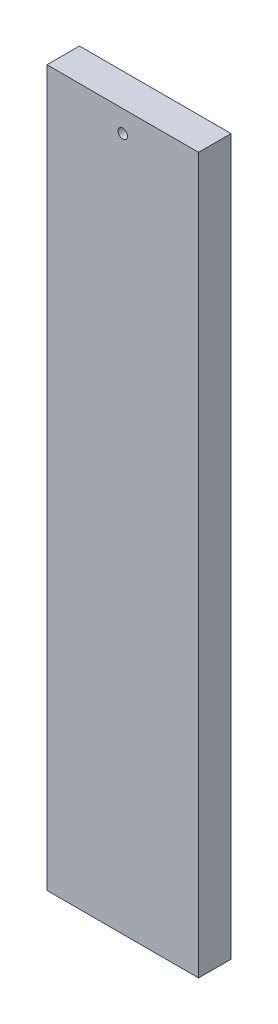
from build123d import *

# Parameters (mm, degrees)
SKETCH1_W           = 88.9
SKETCH1_H           = 19.05
BOSS_EXTRUDE1_DEPTH = 419.1
SKETCH2_R           = 2.778125
CUT_EXTRUDE1_DEPTH  = 429.848367725


with BuildPart() as part:
    # Sketch1 → Boss-Extrude1 (new body)
    with BuildSketch(Plane(origin=(0, 0, 0), x_dir=(1, 0, 0), z_dir=(0, 1, 0))):
        with Locations((44.45, 9.525)):
            Rectangle(SKETCH1_W, SKETCH1_H)
    extrude(amount=BOSS_EXTRUDE1_DEPTH)

    # Sketch2 → Cut-Extrude1 (cut, through all)
    with BuildSketch(Plane.XY):
        with Locations((44.45, 406.4)):
            Circle(SKETCH2_R)
    extrude(amount=-CUT_EXTRUDE1_DEPTH, mode=Mode.SUBTRACT)


solid = part.part
